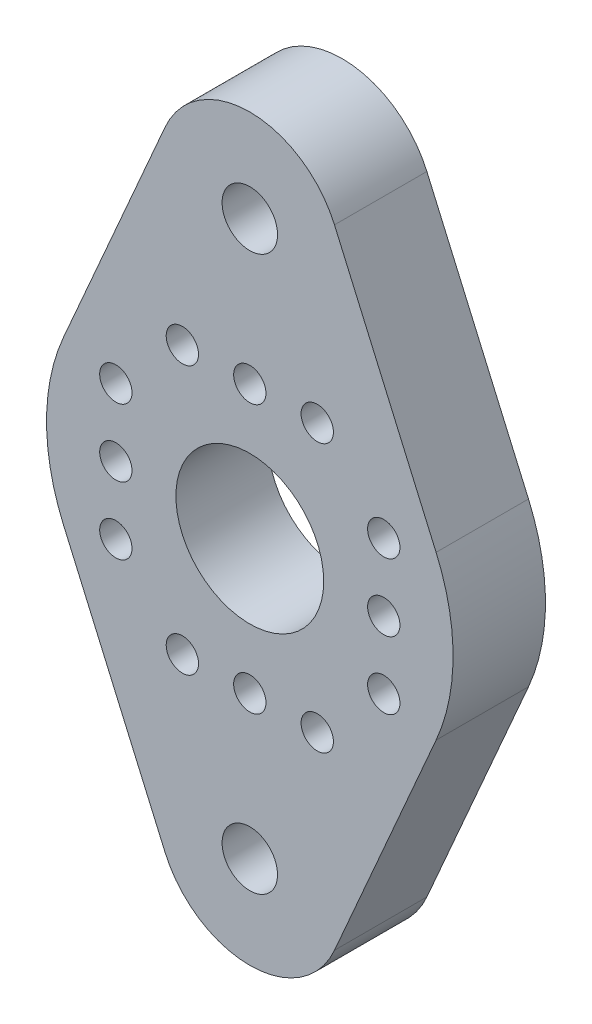
from build123d import *

# Parameters (mm, degrees)
ESQUISSE1_R        = 4
ESQUISSE1_R_2      = 0.875
ESQUISSE1_R_3      = 1.5
BOSS_EXTRU_1_DEPTH = 5


with BuildPart() as part:
    # Esquisse1 → Boss.-Extru.1 (new body)
    with BuildSketch(Plane.XY):
        with BuildLine():
            Line((-10.081666529, 4.4), (-4.582575695, 17))
            ThreePointArc((-4.582575695, 17), (0, 20), (4.582575695, 17))
            Line((4.582575695, 17), (10.081666529, 4.4))
            ThreePointArc((10.081666529, 4.4), (11, 0), (10.081666529, -4.4))
            Line((10.081666529, -4.4), (4.582575695, -17))
            ThreePointArc((4.582575695, -17), (0, -20), (-4.582575695, -17))
            Line((-4.582575695, -17), (-10.081666529, -4.4))
            ThreePointArc((-10.081666529, -4.4), (-11, 0), (-10.081666529, 4.4))
        make_face()
        Circle(ESQUISSE1_R, mode=Mode.SUBTRACT)
        with Locations((7.25, 0)):
            Circle(ESQUISSE1_R_2, mode=Mode.SUBTRACT)
        with Locations((7.25, 3.65)):
            Circle(ESQUISSE1_R_2, mode=Mode.SUBTRACT)
        with Locations((7.25, -3.65)):
            Circle(ESQUISSE1_R_2, mode=Mode.SUBTRACT)
        with Locations((3.65, -7.25)):
            Circle(ESQUISSE1_R_2, mode=Mode.SUBTRACT)
        with Locations((0, -7.25)):
            Circle(ESQUISSE1_R_2, mode=Mode.SUBTRACT)
        with Locations((-3.65, -7.25)):
            Circle(ESQUISSE1_R_2, mode=Mode.SUBTRACT)
        with Locations((-7.25, -3.65)):
            Circle(ESQUISSE1_R_2, mode=Mode.SUBTRACT)
        with Locations((-7.25, 0)):
            Circle(ESQUISSE1_R_2, mode=Mode.SUBTRACT)
        with Locations((-7.25, 3.65)):
            Circle(ESQUISSE1_R_2, mode=Mode.SUBTRACT)
        with Locations((-3.65, 7.25)):
            Circle(ESQUISSE1_R_2, mode=Mode.SUBTRACT)
        with Locations((0, 7.25)):
            Circle(ESQUISSE1_R_2, mode=Mode.SUBTRACT)
        with Locations((3.65, 7.25)):
            Circle(ESQUISSE1_R_2, mode=Mode.SUBTRACT)
        with Locations((0, 15)):
            Circle(ESQUISSE1_R_3, mode=Mode.SUBTRACT)
        with Locations((0, -15)):
            Circle(ESQUISSE1_R_3, mode=Mode.SUBTRACT)
    extrude(amount=BOSS_EXTRU_1_DEPTH)


solid = part.part
